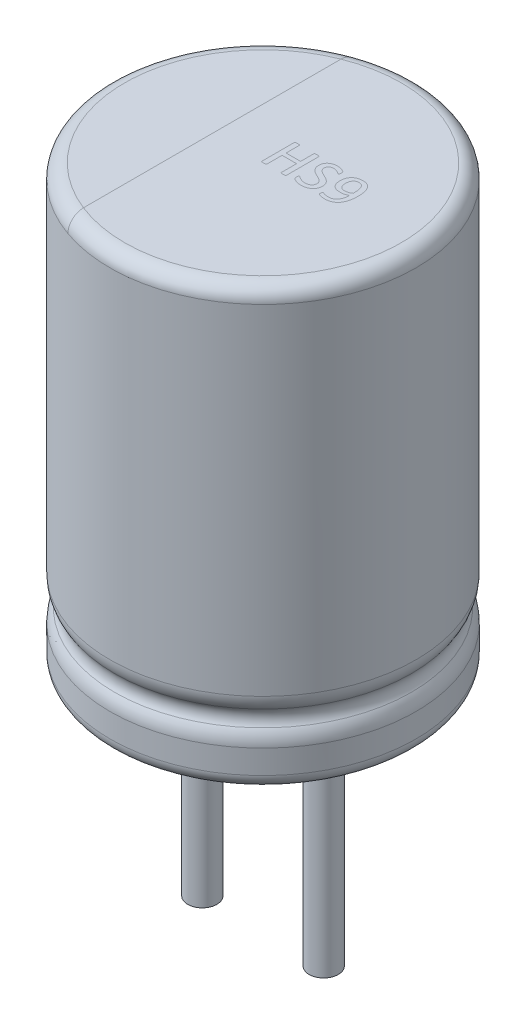
from build123d import *

# Parameters (mm, degrees)
FILLET_1_R          = 0.5
SKETCH_2_R          = 2.15
CUT_EXTRUDE_1_DEPTH = 0.3
FILLET_2_R          = 0.3
SKETCH_3_R          = 0.3
EXTRUDE_1_DEPTH     = 5
EXTRUDE_1_2_DEPTH   = 5


with BuildPart() as part:
    # Эскиз1 → Повернуть1 (revolve)
    with BuildSketch(Plane(origin=(0, 0, 0), x_dir=(0, 0, -1), z_dir=(1, 0, 0))):
        with BuildLine():
            Line((0, 0), (-2.85, 0))
            ThreePointArc((-2.85, 0), (-3.062132034, 0.087867966), (-3.15, 0.3))
            Line((-3.15, 0.3), (-3.15, 1))
            ThreePointArc((-3.15, 1), (-2.999835492, 1.25), (-3.15, 1.5))
            Line((-3.15, 1.5), (-3.15, 8.7))
            ThreePointArc((-3.15, 8.7), (-3.062132034, 8.912132034), (-2.85, 9))
            Line((-2.85, 9), (0, 9))
            Line((0, 9), (0, 0))
        make_face()
    revolve(axis=Axis((0, 14.239800306, 0), (0, -1, 0)))

    # Скругление1
    fillet_1_edges = [part.edges().sort_by_distance(p)[0] for p in [
        (0, 1.5, -3.15),
        (0, 1, -3.15),
    ]]
    fillet(fillet_1_edges, radius=FILLET_1_R)

    # Эскиз2 → Вырез-Вытянуть1 (cut)
    with BuildSketch(Plane.XZ):
        with Locations(Location((0, 0, 0), (0, 0, 270))):
            Circle(SKETCH_2_R)
    extrude(amount=-CUT_EXTRUDE_1_DEPTH, mode=Mode.SUBTRACT)

    # Скругление2
    fillet_2_edges = [part.edges().sort_by_distance(p)[0] for p in [
        (0, 0, 2.15),
    ]]
    fillet(fillet_2_edges, radius=FILLET_2_R - 0.0001)  # a hair under: the kernel refuses the full size


with BuildPart() as body_2:
    # Эскиз3 → Бобышка-Вытянуть1 (new body)
    with BuildSketch(Plane.XZ.offset(-0.3)):
        with Locations(Location((-1.25, 0, 0), (0, 0, 270))):
            Circle(SKETCH_3_R)
    extrude(amount=EXTRUDE_1_DEPTH)


with BuildPart() as body_3:
    # Эскиз3 → Extrude 1 2 (new body)
    with BuildSketch(Plane.XZ.offset(-0.3)):
        with Locations(Location((1.25, 0, 0), (0, 0, 90))):
            Circle(SKETCH_3_R)
    extrude(amount=EXTRUDE_1_2_DEPTH)


solid = Compound([part.part, body_2.part, body_3.part])
